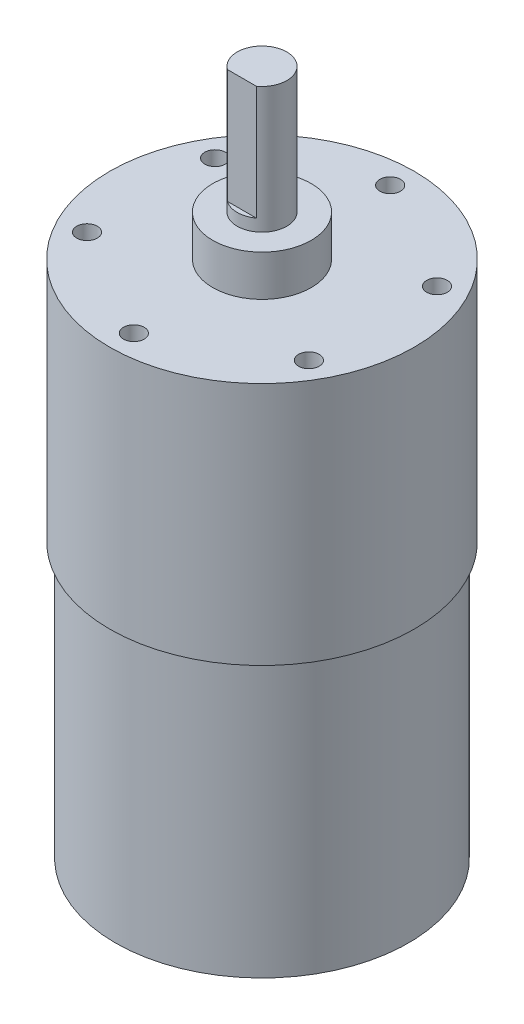
from build123d import *

# Parameters (mm, degrees)
SKETCH1_R                       = 18.4277
BOSS_EXTRUDE1_DEPTH             = 29.5402
SKETCH2_R                       = 5.9563
BOSS_EXTRUDE2_DEPTH             = 4.953
SKETCH3_R                       = 3
BOSS_EXTRUDE3_DEPTH             = 15.2654
CUT_EXTRUDE1_DEPTH              = 13.8176
SKETCH5_R                       = 17.7419
BOSS_EXTRUDE4_DEPTH             = 33.2232
SKETCH6_R                       = 5.0292
BOSS_EXTRUDE5_DEPTH             = 3.048
CHAMFER1_SIZE                   = 1.5875
TAP_DRILL_FOR_M3X0_5_TAP1_D     = 2.5
TAP_DRILL_FOR_M3X0_5_TAP1_DEPTH = 5.08
TAP_DRILL_FOR_M3X0_5_TAP1_TIP   = 0.751075774


with BuildPart() as part:
    # Sketch1 → Boss-Extrude1 (new body)
    with BuildSketch(Plane(origin=(0, 0, 0), x_dir=(1, 0, 0), z_dir=(0, 1, 0))):
        with Locations(Location((0, 0, 0), (0, 0, 270))):
            Circle(SKETCH1_R)
    extrude(amount=BOSS_EXTRUDE1_DEPTH)

    # Sketch2 → Boss-Extrude2 (add)
    with BuildSketch(Plane(origin=(0, 29.5402, 0), x_dir=(1, 0, 0), z_dir=(0, 1, 0))):
        with Locations(Location((0, 0, 0), (0, 0, 270))):
            Circle(SKETCH2_R)
    extrude(amount=BOSS_EXTRUDE2_DEPTH)

    # Sketch3 → Boss-Extrude3 (add)
    with BuildSketch(Plane(origin=(0, 34.4932, 0), x_dir=(1, 0, 0), z_dir=(0, 1, 0))):
        with Locations(Location((0, 0, 0), (0, 0, 270))):
            Circle(SKETCH3_R)
    extrude(amount=BOSS_EXTRUDE3_DEPTH)

    # Sketch4 → Cut-Extrude1 (cut)
    with BuildSketch(Plane(origin=(0, 49.7586, 0), x_dir=(1, 0, 0), z_dir=(0, 1, 0))):
        with BuildLine():
            Line((-1.75155103, -2.435592791), (1.75155103, -2.435592791))
            ThreePointArc((1.75155103, -2.435592791), (0, -3.000007209), (-1.75155103, -2.435592791))
        make_face()
    extrude(amount=-CUT_EXTRUDE1_DEPTH, mode=Mode.SUBTRACT)

    # Sketch5 → Boss-Extrude4 (add)
    with BuildSketch(Plane.XZ):
        with Locations(Location((0, 0, 0), (0, 0, 270))):
            Circle(SKETCH5_R)
    extrude(amount=BOSS_EXTRUDE4_DEPTH)

    # Sketch6 → Boss-Extrude5 (add)
    with BuildSketch(Plane(origin=(0, -33.2232, 0), x_dir=(-1, 0, 0), z_dir=(0, -1, 0))):
        with Locations(Location((0, 0, 0), (0, 0, 90))):
            Circle(SKETCH6_R)
    extrude(amount=BOSS_EXTRUDE5_DEPTH)

    # Chamfer1
    chamfer1_edges = [part.edges().sort_by_distance(p)[0] for p in [
        (0, -36.2712, 5.0292),
    ]]
    chamfer(chamfer1_edges, length=CHAMFER1_SIZE)

    # Tap Drill for M3x0.5 Tap1
    with Locations(Plane(origin=(0, 29.5402, 0), x_dir=(1, 0, 0), z_dir=(0, 1, 0))):
        with Locations((0, 15.5), (13.423393759, 7.75), (13.423393759, -7.75), (0, -15.5), (-13.423393759, -7.75), (-13.423393759, 7.75)):
            Hole(TAP_DRILL_FOR_M3X0_5_TAP1_D / 2, depth=TAP_DRILL_FOR_M3X0_5_TAP1_DEPTH)
            with Locations((0, 0, -(TAP_DRILL_FOR_M3X0_5_TAP1_DEPTH + TAP_DRILL_FOR_M3X0_5_TAP1_TIP / 2))):  # 118° drill point
                Cone(0, TAP_DRILL_FOR_M3X0_5_TAP1_D / 2, TAP_DRILL_FOR_M3X0_5_TAP1_TIP, mode=Mode.SUBTRACT)


solid = part.part
